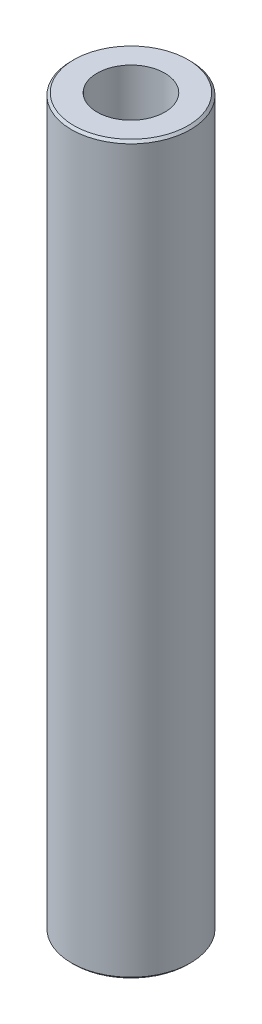
from build123d import *

# Parameters (mm, degrees)
SKETCH1_R           = 7.5
BOSS_EXTRUDE1_DEPTH = 91.6175031
SKETCH2_R           = 4.267082099
CUT_EXTRUDE1_DEPTH  = 93.229425209
CHAMFER1_SIZE       = 0.294824379


with BuildPart() as part:
    # Sketch1 → Boss-Extrude1 (new body)
    with BuildSketch(Plane(origin=(0, 0, 0), x_dir=(1, 0, 0), z_dir=(0, 1, 0))):
        Circle(SKETCH1_R)
    extrude(amount=BOSS_EXTRUDE1_DEPTH)

    # Sketch2 → Cut-Extrude1 (cut, through all)
    with BuildSketch(Plane(origin=(0, 0, 0), x_dir=(1, 0, 0), z_dir=(0, 1, 0))):
        Circle(SKETCH2_R)
    extrude(amount=CUT_EXTRUDE1_DEPTH, mode=Mode.SUBTRACT)

    # Chamfer1
    chamfer1_edges = [part.edges().sort_by_distance(p)[0] for p in [
        (-7.5, 91.6175031, 0),
        (-7.5, 0, 0),
    ]]
    chamfer(chamfer1_edges, length=CHAMFER1_SIZE)


solid = part.part
